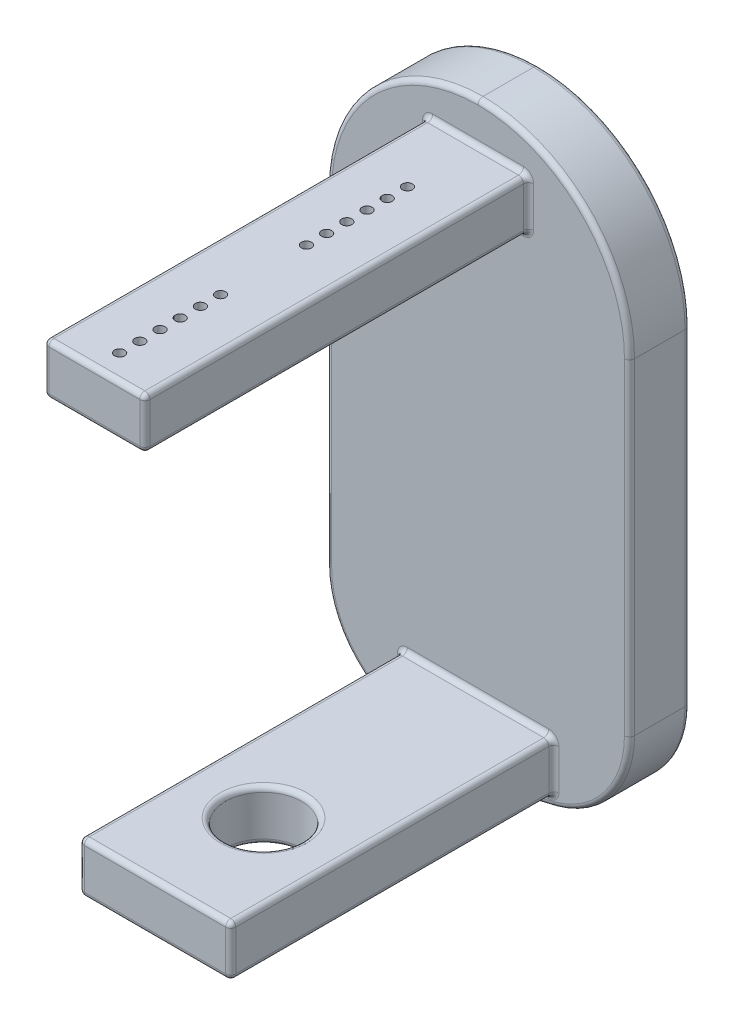
from build123d import *

# Parameters (mm, degrees)
SKETCH1_R           = 29
BOSS_EXTRUDE1_DEPTH = 6
CUT_EXTRUDE3_START  = -10
CUT_EXTRUDE3_DEPTH  = 10
FILLET2_R           = 15
FILLET3_R           = 10
SKETCH2_W           = 10
SKETCH2_H           = 5
BOSS_EXTRUDE2_DEPTH = 38
SKETCH3_R           = 0.5
CUT_EXTRUDE1_DEPTH  = 5
SKETCH4_W           = 15
SKETCH4_H           = 5
BOSS_EXTRUDE3_DEPTH = 32
SKETCH5_R           = 3.8
CUT_EXTRUDE2_DEPTH  = 28
FILLET4_R           = 0.5


with BuildPart() as part:
    # Sketch1 → Boss-Extrude1 (new body)
    with BuildSketch(Plane.XY):
        Circle(SKETCH1_R)
    extrude(amount=BOSS_EXTRUDE1_DEPTH)

    # Sketch6 → Cut-Extrude3 (cut)
    with BuildSketch(Plane.XY.offset(6).offset(CUT_EXTRUDE3_START)):
        with BuildLine():
            Line((-15.004747761, 24.816477281), (-15.004747761, -24.816477281))
            ThreePointArc((-15.004747761, -24.816477281), (-29, 0), (-15.004747761, 24.816477281))
        make_face()
        with BuildLine():
            Line((14.995252239, 24.822216063), (14.995252239, -24.822216063))
            ThreePointArc((14.995252239, -24.822216063), (29, 0), (14.995252239, 24.822216063))
        make_face()
    extrude(amount=CUT_EXTRUDE3_DEPTH, mode=Mode.SUBTRACT)

    # Fillet2
    fillet2_edges = [part.edges().sort_by_distance(p)[0] for p in [
        (-15.004747761, 24.816477281, 3),
        (14.995252239, 24.822216063, 3),
    ]]
    fillet(fillet2_edges, radius=FILLET2_R - 0.0001)  # a hair under: the kernel refuses the full size

    # Fillet3
    fillet3_edges = [part.edges().sort_by_distance(p)[0] for p in [
        (-15.004747761, -24.816477281, 3),
        (14.995252239, -24.822216063, 3),
    ]]
    fillet(fillet3_edges, radius=FILLET3_R)

    # Sketch2 → Boss-Extrude2 (add)
    with BuildSketch(Plane.XY.offset(6)):
        with Locations((0, 22.5)):
            Rectangle(SKETCH2_W, SKETCH2_H)
    extrude(amount=BOSS_EXTRUDE2_DEPTH)

    # Sketch3 → Cut-Extrude1 (cut)
    with BuildSketch(Plane(origin=(0, 25, 0), x_dir=(1, 0, 0), z_dir=(0, 1, 0))):
        with Locations(Location((0, -13, 0), (0, 0, 270))):
            Circle(SKETCH3_R)
        with Locations(Location((0, -15, 0), (0, 0, 270))):
            Circle(SKETCH3_R)
        with Locations(Location((0, -17, 0), (0, 0, 270))):
            Circle(SKETCH3_R)
        with Locations(Location((0, -19, 0), (0, 0, 270))):
            Circle(SKETCH3_R)
        with Locations(Location((0, -21, 0), (0, 0, 270))):
            Circle(SKETCH3_R)
        with Locations(Location((0, -23, 0), (0, 0, 270))):
            Circle(SKETCH3_R)
        with Locations(Location((0, -41.5, 0), (0, 0, 270))):
            Circle(SKETCH3_R)
        with Locations(Location((0, -39.5, 0), (0, 0, 270))):
            Circle(SKETCH3_R)
        with Locations(Location((0, -37.5, 0), (0, 0, 270))):
            Circle(SKETCH3_R)
        with Locations(Location((0, -35.5, 0), (0, 0, 270))):
            Circle(SKETCH3_R)
        with Locations(Location((0, -33.5, 0), (0, 0, 270))):
            Circle(SKETCH3_R)
        with Locations(Location((0, -31.5, 0), (0, 0, 270))):
            Circle(SKETCH3_R)
    extrude(amount=-CUT_EXTRUDE1_DEPTH, mode=Mode.SUBTRACT)

    # Sketch4 → Boss-Extrude3 (add)
    with BuildSketch(Plane.XY.offset(6)):
        with Locations((0, -24.5)):
            Rectangle(SKETCH4_W, SKETCH4_H)
    extrude(amount=BOSS_EXTRUDE3_DEPTH)

    # Sketch5 → Cut-Extrude2 (cut)
    with BuildSketch(Plane(origin=(0, -22, 0), x_dir=(1, 0, 0), z_dir=(0, 1, 0))):
        with Locations(Location((0, -27.25, 0), (0, 0, 270))):
            Circle(SKETCH5_R)
    extrude(amount=-CUT_EXTRUDE2_DEPTH, mode=Mode.SUBTRACT)

    # Fillet4
    fillet4_edges = [part.edges().sort_by_distance(p)[0] for p in [
        (7.5, -24.5, 6),
        (7.5, -27, 22),
        (0, -22, 6),
        (7.5, -22, 22),
        (-7.5, -24.5, 6),
        (-7.5, -22, 22),
        (0, -27, 6),
        (-7.5, -27, 22),
        (7.5, -24.5, 38),
        (0, -22, 38),
        (-7.5, -24.5, 38),
        (0, -27, 38),
        (0, -27, 23.45),
        (0, -22, 23.45),
        (14.995252239, -2.165748974, 6),
        (10.600122519, 24.608390671, 6),
        (-10.613214951, 24.604793667, 6),
        (14.995252239, -2.165748974, 0),
        (10.600122519, 24.608390671, 0),
        (-10.613214951, 24.604793667, 0),
        (-15.004747761, -2.16445395, 6),
        (-15.004747761, -2.16445395, 0),
        (-0.007511337, -28.999999027, 6),
        (12.941660272, -24.402396084, 6),
        (-12.952727935, -24.397747553, 6),
        (-0.007511337, -28.999999027, 0),
        (12.941660272, -24.402396084, 0),
        (-12.952727935, -24.397747553, 0),
        (5, 22.5, 6),
        (5, 20, 25),
        (0, 25, 6),
        (5, 25, 25),
        (-5, 22.5, 6),
        (-5, 25, 25),
        (0, 20, 6),
        (-5, 20, 25),
        (5, 22.5, 44),
        (0, 25, 44),
        (-5, 22.5, 44),
        (0, 20, 44),
    ]]
    fillet(fillet4_edges, radius=FILLET4_R)


solid = part.part
